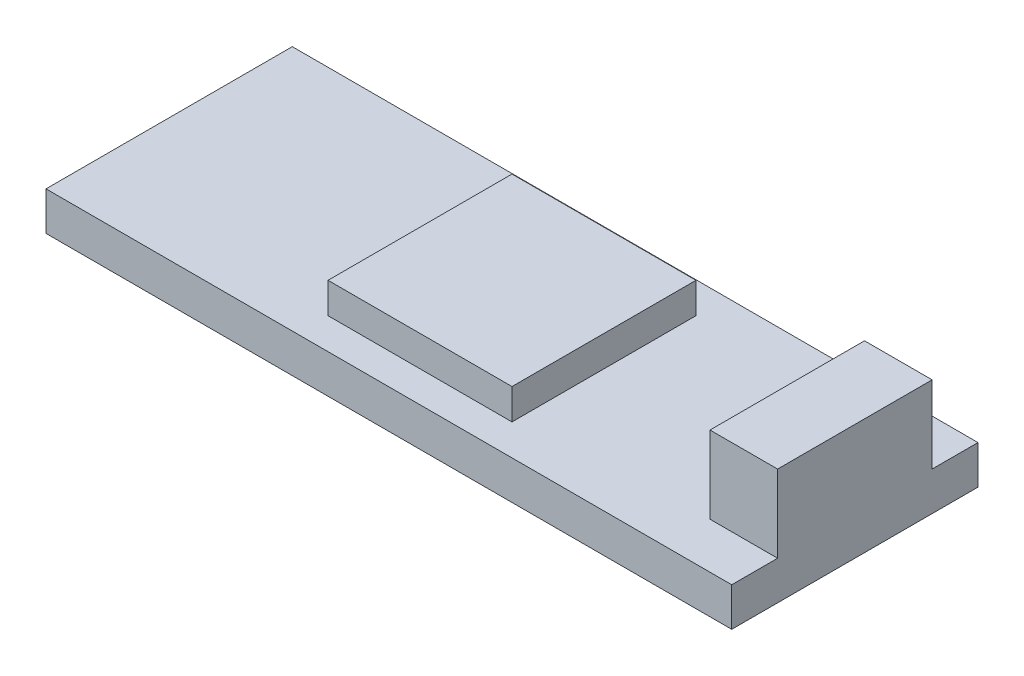
from build123d import *

# Parameters (mm, degrees)
SKETCH1_W           = 71
SKETCH1_H           = 25.5
BOSS_EXTRUDE2_DEPTH = 4
SKETCH4_W           = 7
SKETCH4_H           = 16
BOSS_EXTRUDE3_DEPTH = 8
SKETCH5_W           = 19.05
SKETCH5_H           = 19.05
BOSS_EXTRUDE4_DEPTH = 3.174


with BuildPart() as part:
    # Sketch1 → Boss-Extrude2 (new body)
    with BuildSketch(Plane(origin=(0, 0, 0), x_dir=(1, 0, 0), z_dir=(0, 1, 0))):
        Rectangle(SKETCH1_W, SKETCH1_H)
    extrude(amount=BOSS_EXTRUDE2_DEPTH)

    # Sketch4 → Boss-Extrude3 (add)
    with BuildSketch(Plane(origin=(0, 4, 0), x_dir=(1, 0, 0), z_dir=(0, 1, 0))):
        with Locations((32, 0)):
            Rectangle(SKETCH4_W, SKETCH4_H)
    extrude(amount=BOSS_EXTRUDE3_DEPTH)

    # Sketch5 → Boss-Extrude4 (add)
    with BuildSketch(Plane(origin=(0, 4, 0), x_dir=(1, 0, 0), z_dir=(0, 1, 0))):
        Rectangle(SKETCH5_W, SKETCH5_H)
    extrude(amount=BOSS_EXTRUDE4_DEPTH)


solid = part.part
